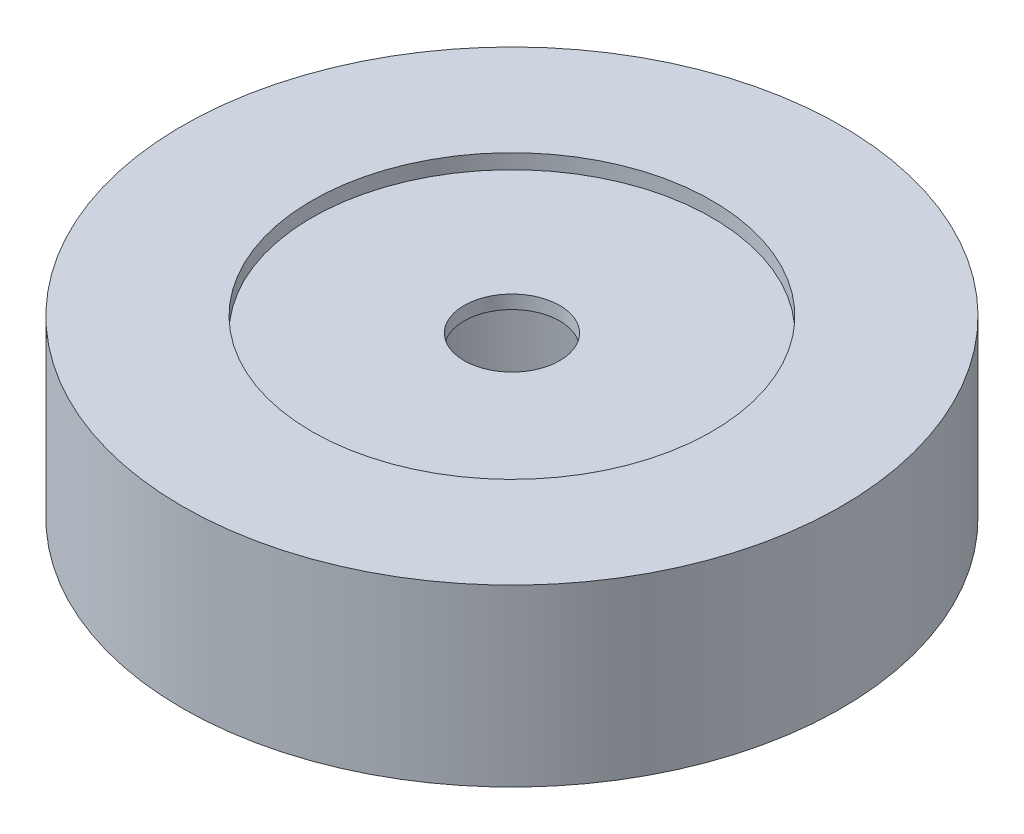
from build123d import *

# Parameters (mm, degrees)
SKETCH1_R           = 227.33
SKETCH1_R_2         = 33
BOSS_EXTRUDE1_DEPTH = 120.65
SKETCH2_R           = 120.5
CUT_EXTRUDE1_DEPTH  = 101.22
SKETCH3_R           = 138
CUT_EXTRUDE2_DEPTH  = 10.16


with BuildPart() as part:
    # Sketch1 → Boss-Extrude1 (new body)
    with BuildSketch(Plane(origin=(0, 0, 0), x_dir=(1, 0, 0), z_dir=(0, 1, 0))):
        Circle(SKETCH1_R)
        Circle(SKETCH1_R_2, mode=Mode.SUBTRACT)
    extrude(amount=BOSS_EXTRUDE1_DEPTH)

    # Sketch2 → Cut-Extrude1 (cut)
    with BuildSketch(Plane.XZ):
        Circle(SKETCH2_R)
    extrude(amount=-CUT_EXTRUDE1_DEPTH, mode=Mode.SUBTRACT)

    # Sketch3 → Cut-Extrude2 (cut)
    with BuildSketch(Plane(origin=(0, 120.65, 0), x_dir=(1, 0, 0), z_dir=(0, 1, 0))):
        Circle(SKETCH3_R)
    extrude(amount=-CUT_EXTRUDE2_DEPTH, mode=Mode.SUBTRACT)


solid = part.part
